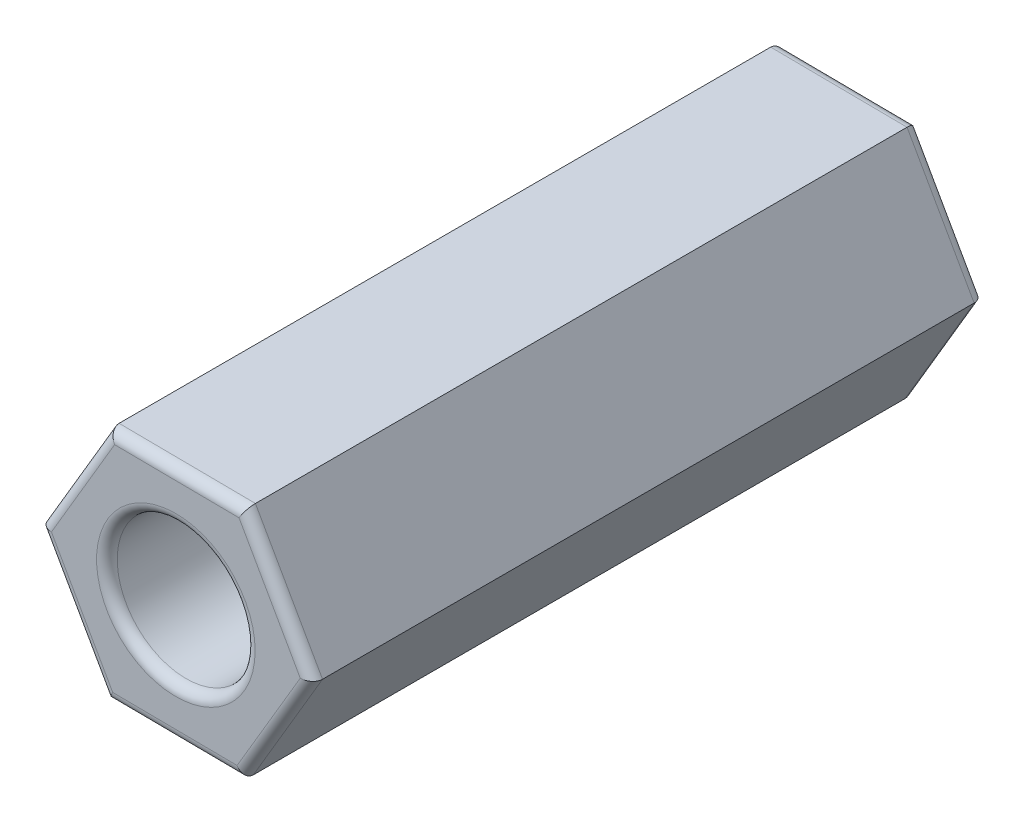
from build123d import *
from build123d.topology import SkipClean

# Parameters (mm, degrees)
EXTRUDE_1_DEPTH     = 19.5
CUT_EXTRUDE_1_DEPTH = 12.5
SKETCH_3_R          = 2
CUT_EXTRUDE_2_DEPTH = 4
FILLET_1_R          = 0.3
FILLET_2_R          = 0.2


with BuildPart() as part:
    # Эскиз1 → Бобышка-Вытянуть1 (new body)
    with BuildSketch(Plane.XY):
        Polygon((2.008322, 3.406975), (-1.946366, 3.442745), (-3.954688, 0.03577), (-2.008322, -3.406975), (1.946366, -3.442745), (3.954688, -0.03577), align=None)
    extrude(amount=EXTRUDE_1_DEPTH)

    # Эскиз2 → Вырез-Вытянуть1 (cut)
    with BuildSketch(Plane.XY.offset(19.5)):
        with BuildLine():
            Line((-1.322876, 1.5), (1.322876, 1.5))
            ThreePointArc((1.322876, 1.5), (0, -2), (-1.322876, 1.5))
        make_face()
    extrude(amount=-CUT_EXTRUDE_1_DEPTH, mode=Mode.SUBTRACT)

    # Эскиз3 → Вырез-Вытянуть2 (cut)
    with SkipClean():  # the faces are left unmerged after this step: merging them gives an invalid solid
        with BuildSketch(Plane.XY.offset(19.5)):
            Circle(SKETCH_3_R)
        extrude(amount=-CUT_EXTRUDE_2_DEPTH, mode=Mode.SUBTRACT)

    # Скругление1
    fillet_1_edges = [part.edges().sort_by_distance(p)[0] for p in [
        (-2.950527, 1.739258, 19.5),
        (-2.981505, -1.685602, 19.5),
        (-0.030978, -3.42486, 19.5),
        (2.950527, -1.739258, 19.5),
        (-0.822876, -1.822876, 19.5),
        (2.981505, 1.685602, 19.5),
        (2.950527, -1.739258, 0),
        (-0.030978, -3.42486, 0),
        (-2.981505, -1.685602, 0),
        (0.030978, 3.42486, 19.5),
        (-2.950527, 1.739258, 0),
        (0.030978, 3.42486, 0),
        (2.981505, 1.685602, 0),
    ]]
    fillet(fillet_1_edges, radius=FILLET_1_R)

    # Скругление2
    # the kernel refuses this fillet: 0.2 mm, written as the material it takes off along each edge
    with BuildSketch(Plane(origin=(1.822876, 1.5, 15.5), x_dir=(0, 1, 0), z_dir=(-1, 0, 0))) as fillet_2_piece_1_section:
        with BuildLine():
            CenterArc((FILLET_2_R, FILLET_2_R), FILLET_2_R, 180, 90)
            Line((0, FILLET_2_R), (0, 0))
            Line((0, 0), (FILLET_2_R, 0))
        make_face()
    fillet_2_piece_1 = extrude(amount=3.645751, mode=Mode.PRIVATE)
    fillet_2_piece_1 = fillet_2_piece_1 & Plane(origin=(0, 0, 15.453639), x_dir=(0.6614378277661478, 0.75, 0), z_dir=(0, 0, 1)) * Cylinder(2, 9, mode=Mode.PRIVATE)
    add(fillet_2_piece_1, mode=Mode.SUBTRACT)


solid = part.part
